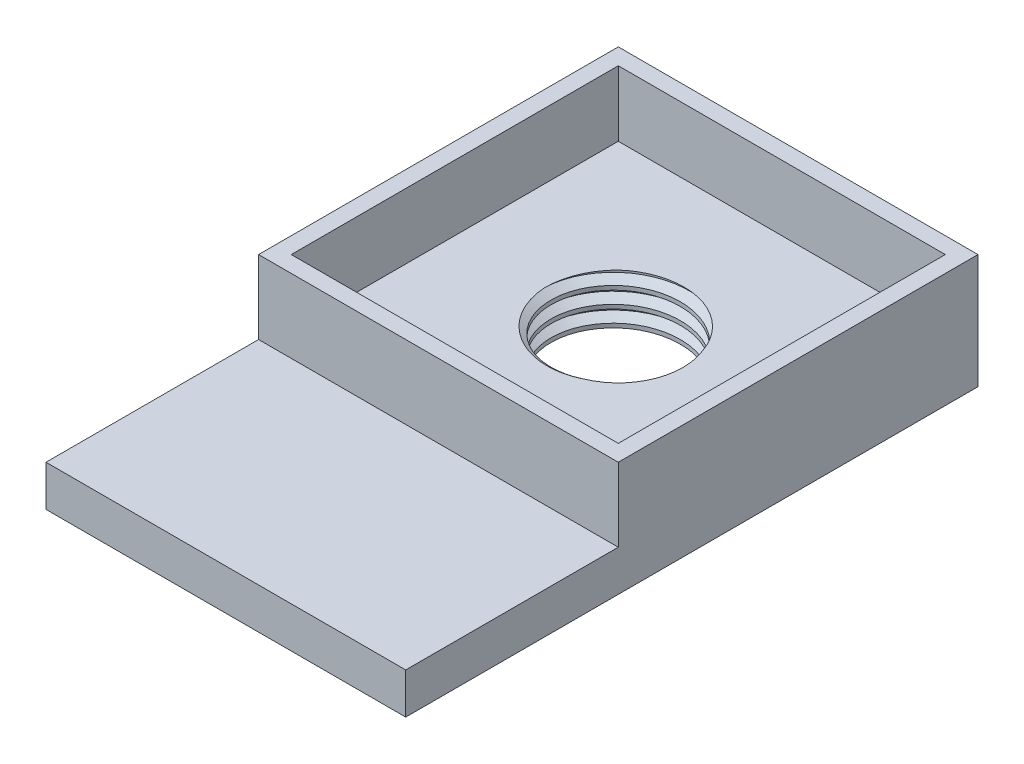
from build123d import *

# Parameters (mm, degrees)
BOSS_EXTRUDE1_DEPTH      = 5
BOSS_EXTRUDE1_DEPTH_BACK = 2
SKETCH1_W                = 22
SKETCH1_H                = 22
SKETCH1_W_2              = 20
SKETCH1_H_2              = 20
BOSS_EXTRUDE2_DEPTH      = 1
BOSS_EXTRUDE2_DEPTH_BACK = 2
SKETCH1_2_W              = 20
SKETCH1_2_H              = 20
SKETCH2_3_R              = 4.5
CUT_EXTRUDE1_DEPTH       = 7
BOSS_EXTRUDE3_DEPTH      = 2
THREAD2_PITCH            = 1
THREAD2_FROM             = 1
THREAD2_TO               = 4
SKETCH20_W               = 22
SKETCH20_H               = 13
BOSS_EXTRUDE4_DEPTH      = 0.5


with BuildPart() as part:
    # Sketch1 → Boss-Extrude1 (new, two sides: drawn at the far end of the back side and taken through both)
    with BuildSketch(Plane(origin=(0, 0, 0), x_dir=(1, 0, 0), z_dir=(0, 1, 0)).offset(-BOSS_EXTRUDE1_DEPTH_BACK)):
        Rectangle(SKETCH1_W, SKETCH1_H)
        Rectangle(SKETCH1_W_2, SKETCH1_H_2, mode=Mode.SUBTRACT)
    extrude(amount=BOSS_EXTRUDE1_DEPTH + BOSS_EXTRUDE1_DEPTH_BACK)

    # Sketch1<2> → Boss-Extrude2 (add, two sides: drawn at the far end of the back side and taken through both)
    with BuildSketch(Plane(origin=(0, 0, 0), x_dir=(1, 0, 0), z_dir=(0, 1, 0)).offset(-BOSS_EXTRUDE2_DEPTH_BACK)):
        Rectangle(SKETCH1_2_W, SKETCH1_2_H)
    extrude(amount=BOSS_EXTRUDE2_DEPTH + BOSS_EXTRUDE2_DEPTH_BACK)

    # Sketch2<3> → Cut-Extrude1 (cut)
    with BuildSketch(Plane.XZ.offset(2)):
        with Locations(Location((0, 0, 0), (0, 0, 270))):
            Circle(SKETCH2_3_R)
    extrude(amount=-CUT_EXTRUDE1_DEPTH, mode=Mode.SUBTRACT)

    # Sketch3 → Boss-Extrude3 (add)
    with BuildSketch(Plane(origin=(0, 0, 0), x_dir=(1, 0, 0), z_dir=(0, 1, 0))):
        Polygon((11, -11), (0, -11), (0, -20), (8, -20), (8, -24), (10.75, -24), (11, -24), align=None)
        Polygon((0, -20), (0, -11), (-11, -11), (-11, -24), (-10.75, -24), (-9.902677218, -24), (-8, -24), (-8, -20), align=None)
        Polygon((0, -24), (0, -20), (-8, -20), (-1, -21.75), (-1, -24), align=None)
        Polygon((-1, -21.75), (-8, -20), (-3, -24), (-2.000639594, -24), (-1, -24), align=None)
        Polygon((-3, -24), (-8, -20), (-8, -24), align=None)
        Polygon((8, -20), (0, -20), (0, -24), (1, -24), (1, -21.75), align=None)
        Polygon((3, -24), (8, -20), (1, -21.75), (1, -24), align=None)
        Polygon((8, -24), (8, -20), (3, -24), align=None)
    extrude(amount=-BOSS_EXTRUDE3_DEPTH)

    # Thread2: arcs per turn and ends read off the stored shape
    # Thread2: the profile of Thread Profile3 profile screwed along a right-hand helix through 10 turns, 8 arcs to a turn; built about Z, then put on its axis
    thread2_z = Axis((0, 0, 0), (0, 0, 1))
    thread2_corners = [(4.5003, 0, -0.000173205), (4.5003, 0, 0.875173202), (3.958734125, 0, 0.562499999), (3.958734125, 0, 0.312499999)]
    with BuildLine(mode=Mode.PRIVATE) as thread2_profile:
        Line(thread2_corners[0], thread2_corners[1])
        Line(thread2_corners[1], thread2_corners[2])
        Line(thread2_corners[2], thread2_corners[3])
        Line(thread2_corners[3], thread2_corners[0])
    thread2_cap = Face(thread2_profile.wire())
    thread2_turn_angles = [0, 22.5, 45, 67.5, 90, 112.5, 135, 157.5, 180, 202.5, 225, 247.5, 270, 292.5, 315, 337.5, 360]
    thread2_turn_weights = [1, 0.9238795325112867, 1, 0.9238795325112867, 1, 0.9238795325112867, 1, 0.9238795325112867, 1, 0.9238795325112867, 1, 0.9238795325112867, 1, 0.9238795325112867, 1, 0.9238795325112867, 1]
    thread2_turn_rails = [Edge.make_bspline([Vector(p[0], p[1], 0).rotate(thread2_z, thread2_turn_angles[k]) / thread2_turn_weights[k] + Vector(0, 0, p[2] + THREAD2_PITCH * thread2_turn_angles[k] / 360) for k in range(17)], [0, 0, 0, 1, 1, 2, 2, 3, 3, 4, 4, 5, 5, 6, 6, 7, 7, 8, 8, 8], 2, thread2_turn_weights) for p in thread2_corners]
    thread2_turn_sides = [Face.make_surface_from_curves(thread2_turn_rails[p[0]], thread2_turn_rails[p[1]]) for p in [(0, 1), (1, 2), (2, 3), (3, 0)]]
    thread2 = Plane(origin=(0, 2, 0), x_dir=(-1, 0, 0), z_dir=(0, -1, 0)) * split(split(Solid(Shell([*[p.moved(Location((0, 0, THREAD2_PITCH * i))) for i in range(10) for p in thread2_turn_sides], thread2_cap, thread2_cap.rotate(thread2_z, 3600).moved(Location((0, 0, THREAD2_PITCH * 3600 / 360)))])), bisect_by=Plane.XY.offset(THREAD2_FROM), keep=Keep.TOP, mode=Mode.PRIVATE), bisect_by=Plane.XY.offset(THREAD2_TO), keep=Keep.BOTTOM, mode=Mode.PRIVATE)
    add(thread2)

    # Sketch20 → Boss-Extrude4 (add)
    with BuildSketch(Plane(origin=(0, 0, 0), x_dir=(1, 0, 0), z_dir=(0, 1, 0))):
        with Locations((0, -17.5)):
            Rectangle(SKETCH20_W, SKETCH20_H)
    extrude(amount=BOSS_EXTRUDE4_DEPTH)


solid = part.part
